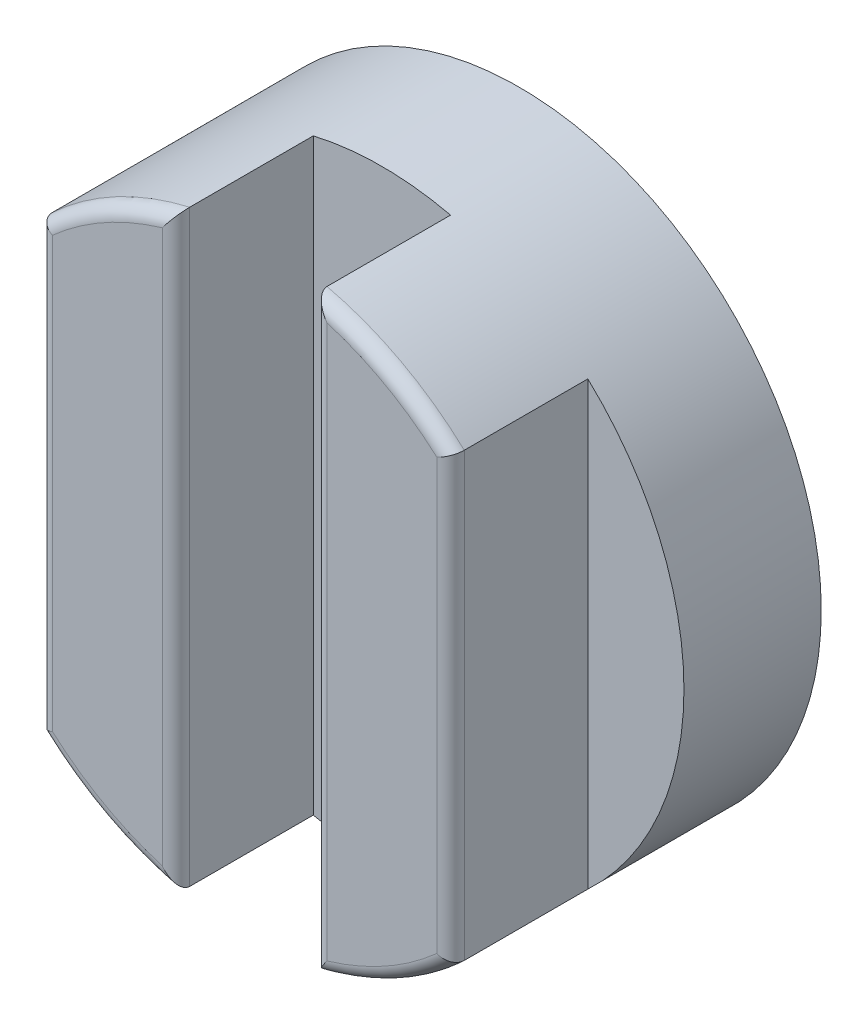
from build123d import *

# Parameters (mm, degrees)
ESQUISSE1_R        = 11
BOSS_EXTRU_1_DEPTH = 5
BOSS_EXTRU_3_DEPTH = 5
CONG_3_R           = 0.5


with BuildPart() as part:
    # Esquisse1 → Boss.-Extru.1 (new body)
    with BuildSketch(Plane.XY):
        Circle(ESQUISSE1_R)
    extrude(amount=BOSS_EXTRU_1_DEPTH)

    # Esquisse2 → Boss.-Extru.3 (add)
    with BuildSketch(Plane.XY.offset(5)):
        with BuildLine():
            ThreePointArc((-2.5, 10.712142643), (-5.174562286, 9.706899873), (-7.5, 8.04673847))
            Line((-7.5, 8.04673847), (-7.5, -8.04673847))
            ThreePointArc((-7.5, -8.04673847), (-5.174562286, -9.706899873), (-2.5, -10.712142643))
            Line((-2.5, -10.712142643), (-2.5, 10.712142643))
        make_face()
        with BuildLine():
            ThreePointArc((7.5, 8.04673847), (5.174562286, 9.706899873), (2.5, 10.712142643))
            Line((2.5, 10.712142643), (2.5, -10.712142643))
            ThreePointArc((2.5, -10.712142643), (5.174562286, -9.706899873), (7.5, -8.04673847))
            Line((7.5, -8.04673847), (7.5, 8.04673847))
        make_face()
    extrude(amount=BOSS_EXTRU_3_DEPTH)

    # Congé3
    cong_3_edges = [part.edges().sort_by_distance(p)[0] for p in [
        (5.174562286, 9.706899873, 10),
        (7.5, 0, 10),
        (2.5, 0, 10),
        (5.174562286, -9.706899873, 10),
        (-5.174562286, -9.706899873, 10),
        (-2.5, 0, 10),
        (-5.174562286, 9.706899873, 10),
        (-7.5, 0, 10),
    ]]
    fillet(cong_3_edges, radius=CONG_3_R)


solid = part.part
